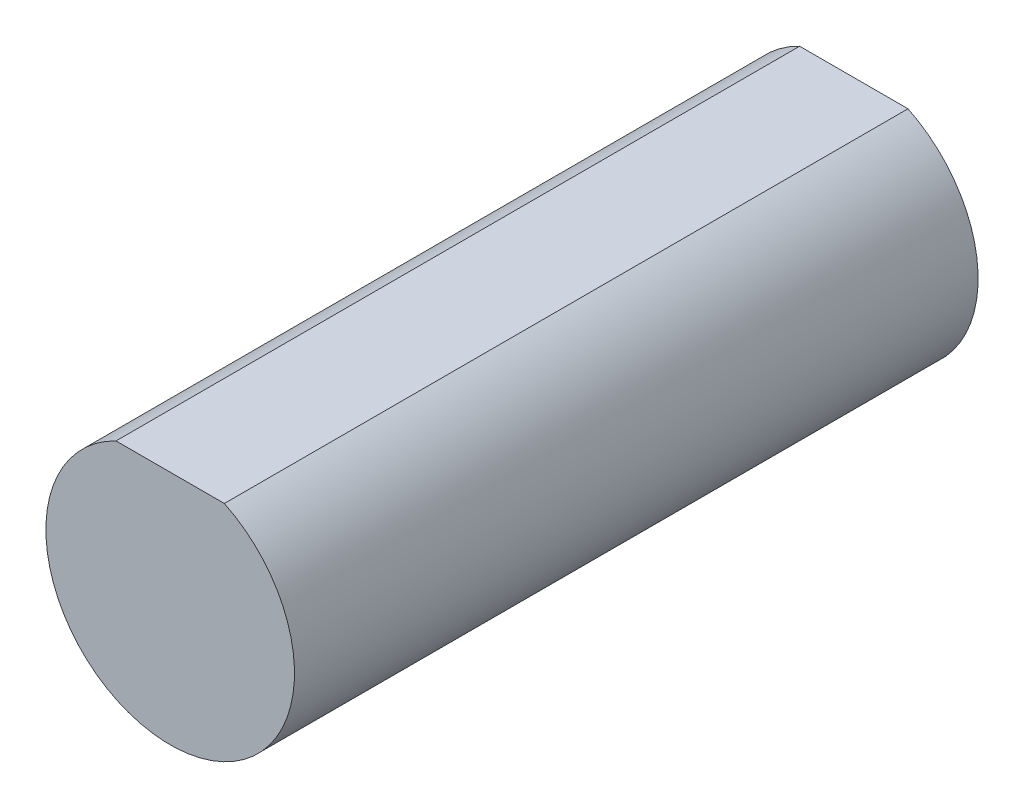
from build123d import *

# Parameters (mm, degrees)
SKETCH_1_R          = 10
EXTRUDE_1_DEPTH     = 55
CUT_EXTRUDE_1_DEPTH = 57.789083458


with BuildPart() as part:
    # 草图1 → 凸台-拉伸1 (new body)
    with BuildSketch(Plane.XY):
        Circle(SKETCH_1_R)
    extrude(amount=EXTRUDE_1_DEPTH)

    # 草图2 → 切除-拉伸1 (cut, through all)
    with BuildSketch(Plane.XY.offset(55)):
        with BuildLine():
            Line((-4.358898944, 9), (4.358898944, 9))
            ThreePointArc((4.358898944, 9), (0, 10), (-4.358898944, 9))
        make_face()
    extrude(amount=-CUT_EXTRUDE_1_DEPTH, mode=Mode.SUBTRACT)


solid = part.part
